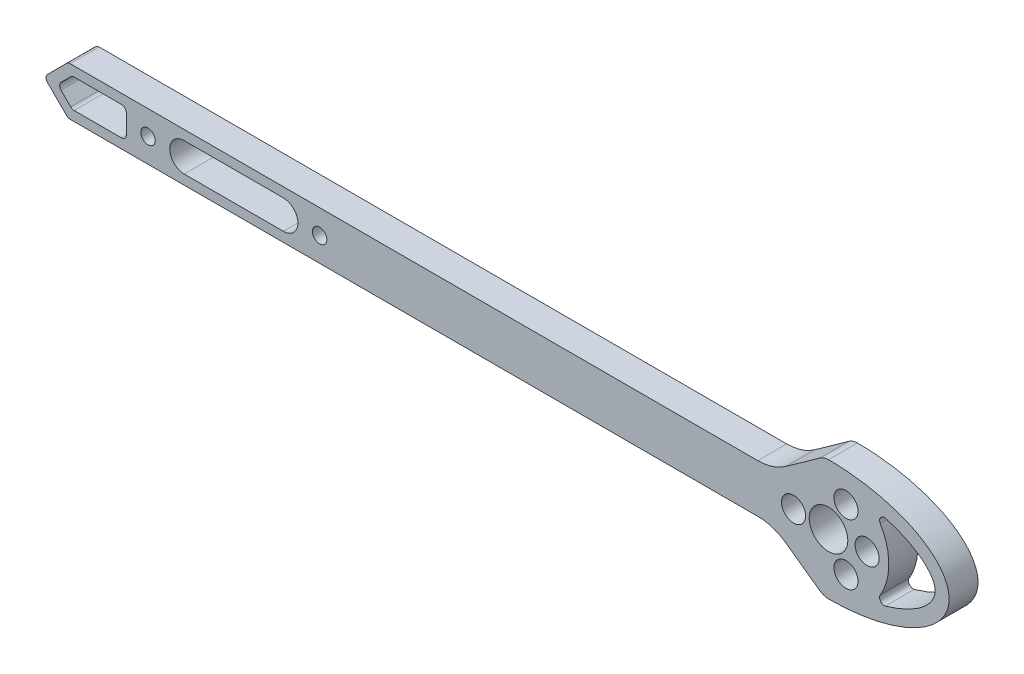
from build123d import *

# Parameters (mm, degrees)
EXTRUDE_1_OUTLINE_R   = 1.5
EXTRUDE_1_OUTLINE_R_2 = 1.25
EXTRUDE_1_OUTLINE_R_3 = 4
EXTRUDE_1_DEPTH       = 6
SKETCH_2_R            = 2.5
CUT_EXTRUDE_1_DEPTH   = 4


# Read off the part's stored shape, not the designer's step: 凸台-拉伸1
with BuildPart() as part:
    # 凸台-拉伸1 outline → 凸台-拉伸1 (new body)
    with BuildSketch(Plane.XY):
        with BuildLine():
            ThreePointArc((66.518501673, -11.857713373), (67.346928296, -12.273709835), (68.262805266, -12.41693379))
            add(Edge.make_bspline(
                [(68.262805266, -12.41693379), (93.262805266, -12.41693379), (93.262805266, 0.08306621), (93.262805266, 12.58306621), (68.262805266, 12.58306621)],
                knots=[4.71238898, 4.71238898, 4.71238898, 6.283185307, 6.283185307, 7.853981634, 7.853981634, 7.853981634], degree=2, weights=[1, 0.707106781, 1, 0.707106781, 1]))
            ThreePointArc((68.262805266, 12.58306621), (67.346928296, 12.439842256), (66.518501673, 12.023845794))
            Line((66.518501673, 12.023845794), (59.414730346, 6.947134266))
            ThreePointArc((59.414730346, 6.947134266), (56.65330827, 5.560479391), (53.600385036, 5.08306621))
            Line((53.600385036, 5.08306621), (-88.957540844, 5.08306621))
            ThreePointArc((-88.957540844, 5.08306621), (-89.340224277, 5.006945743), (-89.664647626, 4.790172992))
            Line((-89.664647626, 4.790172992), (-93.664647626, 0.790172992))
            ThreePointArc((-93.664647626, 0.790172992), (-93.957540844, 0.083066211), (-93.664647626, -0.624040571))
            Line((-93.664647626, -0.624040571), (-89.664647626, -4.624040571))
            ThreePointArc((-89.664647626, -4.624040571), (-89.340224277, -4.840813322), (-88.957540844, -4.91693379))
            Line((-88.957540844, -4.91693379), (53.600385036, -4.91693379))
            ThreePointArc((53.600385036, -4.91693379), (56.65330827, -5.394346971), (59.414730346, -6.781001845))
            Line((59.414730346, -6.781001845), (66.518501673, -11.857713373))
        make_face()
        with BuildLine():
            Line((-88.836220501, -2.624040571), (-90.836220501, -0.624040571))
            ThreePointArc((-90.836220501, -0.624040571), (-91.12911372, 0.08306621), (-90.836220501, 0.790172992))
            Line((-90.836220501, 0.790172992), (-88.836220501, 2.790172992))
            ThreePointArc((-88.836220501, 2.790172992), (-88.511797152, 3.006945743), (-88.12911372, 3.08306621))
            Line((-88.12911372, 3.08306621), (-78.304997581, 3.08306621))
            ThreePointArc((-78.304997581, 3.08306621), (-77.597890799, 2.790172992), (-77.304997581, 2.08306621))
            Line((-77.304997581, 2.08306621), (-77.304997581, -1.91693379))
            ThreePointArc((-77.304997581, -1.91693379), (-77.597890799, -2.624040571), (-78.304997581, -2.91693379))
            Line((-78.304997581, -2.91693379), (-88.12911372, -2.91693379))
            ThreePointArc((-88.12911372, -2.91693379), (-88.511797152, -2.840813322), (-88.836220501, -2.624040571))
        make_face(mode=Mode.SUBTRACT)
        with Locations((-72.804997581, 0.08306621)):
            Circle(EXTRUDE_1_OUTLINE_R, mode=Mode.SUBTRACT)
        with BuildLine():
            Line((-65.304997581, 3.08306621), (-44.737200641, 3.08306621))
            ThreePointArc((-44.737200641, 3.08306621), (-41.737200641, 0.08306621), (-44.737200641, -2.91693379))
            Line((-44.737200641, -2.91693379), (-65.304997581, -2.91693379))
            ThreePointArc((-65.304997581, -2.91693379), (-68.304997581, 0.08306621), (-65.304997581, 3.08306621))
        make_face(mode=Mode.SUBTRACT)
        with Locations((-37.237200641, 0.08306621)):
            Circle(EXTRUDE_1_OUTLINE_R, mode=Mode.SUBTRACT)
        with Locations((71.887805266, -6.195617967)):
            Circle(EXTRUDE_1_OUTLINE_R_2, mode=Mode.SUBTRACT)
        with Locations((61.012805266, 0.08306621)):
            Circle(EXTRUDE_1_OUTLINE_R_2, mode=Mode.SUBTRACT)
        with Locations((68.262805266, 0.08306621)):
            Circle(EXTRUDE_1_OUTLINE_R_3, mode=Mode.SUBTRACT)
        with Locations((76.262805266, 0.08306621)):
            Circle(EXTRUDE_1_OUTLINE_R, mode=Mode.SUBTRACT)
        with BuildLine():
            add(Edge.make_bspline(
                [(80.002486449, -7.827981494), (81.740072236, -7.329549187), (83.32214493, -6.723567409), (85.860509142, -5.461739139), (86.871334656, -4.823478396), (88.496512694, -3.529417693), (89.108425687, -2.87519576), (89.83368514, -1.827156592), (90.039530088, -1.41276875), (90.300594726, -0.644457728), (90.358447033, -0.2904674), (90.363313969, 0.412309658), (90.310435896, 0.76462156), (90.061809507, 1.528318122), (89.863390463, 1.939947571), (89.270491176, 2.816312679), (88.875573555, 3.279429549), (87.874178587, 4.215852429), (87.268241508, 4.688538182), (85.46609678, 5.859582725), (84.128930326, 6.53551807), (81.788884347, 7.440329387), (80.918441463, 7.731405765), (80.005250814, 7.993181566)],
                knots=[5.232758731, 5.232758731, 5.232758731, 5.232758731, 5.494881658, 5.494881658, 5.722476545, 5.722476545, 5.950071431, 5.950071431, 6.114897053, 6.114897053, 6.279722675, 6.279722675, 6.444548297, 6.444548297, 6.609373919, 6.609373919, 6.774199541, 6.774199541, 6.939025163, 6.939025163, 7.195717122, 7.195717122, 7.333470316, 7.333470316, 7.333470316, 7.333470316], degree=3))
            ThreePointArc((80.002486449, -7.827981494), (79.022771165, -7.396579116), (78.994499484, -6.326461944))
            ThreePointArc((78.994499484, -6.326461944), (80.762772001, 0.082794087), (78.994608752, 6.492080264))
            ThreePointArc((78.994608752, 6.492080264), (79.023640703, 7.563300664), (80.005250814, 7.993181566))
        make_face(mode=Mode.SUBTRACT)
        with Locations((71.887805266, 6.361750388)):
            Circle(EXTRUDE_1_OUTLINE_R_2, mode=Mode.SUBTRACT)
    extrude(amount=EXTRUDE_1_DEPTH)

    # 草图2 → 切除-拉伸1 (cut)
    with BuildSketch(Plane.XY.offset(6)):
        with Locations((61.012805266, 0.08306621)):
            Circle(SKETCH_2_R)
        with Locations((71.887805266, 6.361750388)):
            Circle(SKETCH_2_R)
        with Locations((76.262805266, 0.08306621)):
            Circle(SKETCH_2_R)
        with Locations((71.887805266, -6.195617967)):
            Circle(SKETCH_2_R)
    extrude(amount=-CUT_EXTRUDE_1_DEPTH, mode=Mode.SUBTRACT)


solid = part.part
